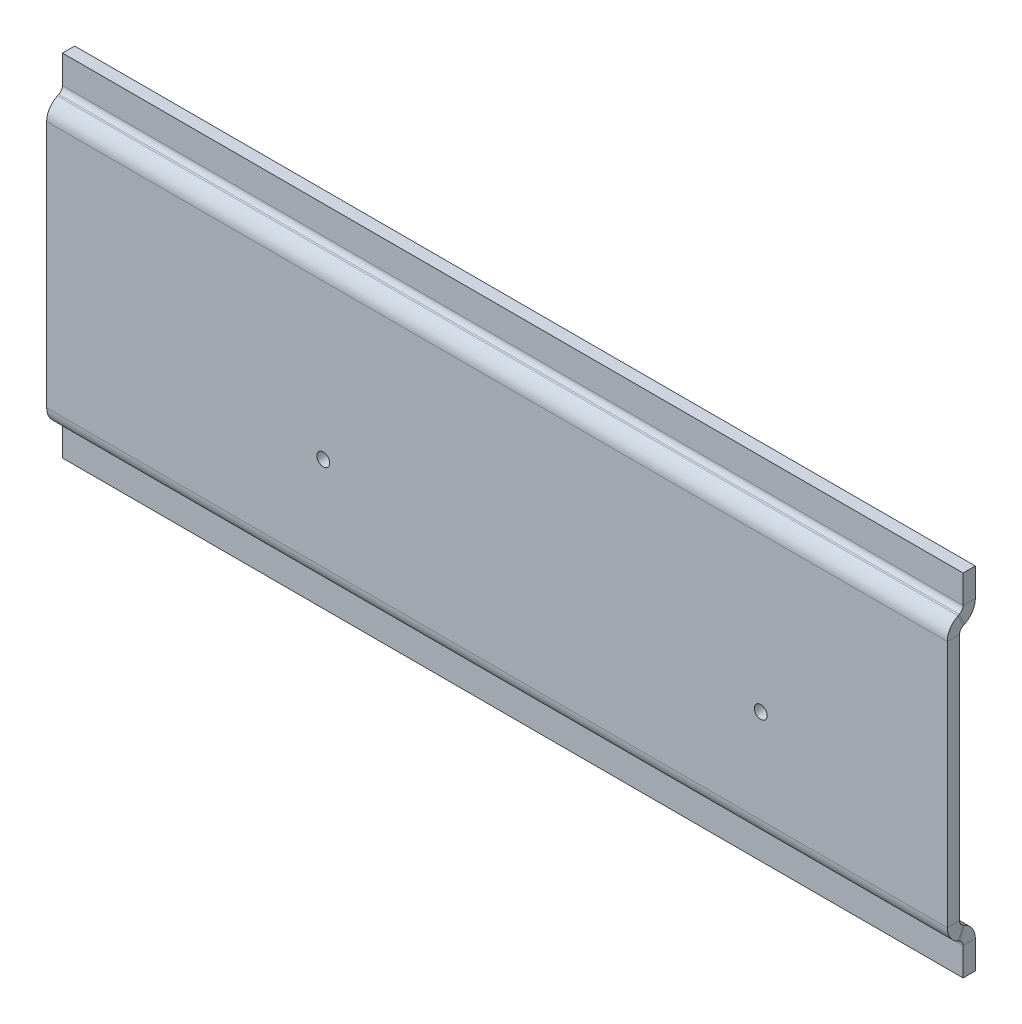
from build123d import *

# Parameters (mm, degrees)
SKETCH1_W                      = 140
SKETCH1_H                      = 44
BASE_FLANGE1_DEPTH             = 1.9
EDGE_FLANGE1_DEPTH             = 140
EDGE_FLANGE1_2_DEPTH           = 140
EDGE_FLANGE2_STRIP_CUT_DEPTH   = 140
EDGE_FLANGE2_STRIP_CUT_2_DEPTH = 140
EDGE_FLANGE2_DEPTH             = 140
EDGE_FLANGE2_BEND_DEPTH        = 140
SKETCH40_R                     = 1
CUT_EXTRUDE1_DEPTH             = 5


# Read off the part's stored shape, not the designer's step: Edge-Flange1
# Sheet-metal steps are written as plain solids
with BuildPart() as part:
    # Sketch1 → Base-Flange1 (new body)
    with BuildSketch(Plane.XY):
        with Locations((70, 22)):
            Rectangle(SKETCH1_W, SKETCH1_H)
    extrude(amount=-BASE_FLANGE1_DEPTH)

    # Edge-Flange1 outline → Edge-Flange1 (cut)
    with BuildSketch(Plane.YZ):
        with BuildLine():
            ThreePointArc((41.266511693, 0), (42.824680557, -0.454164807), (43.894804276, -1.674407041))
            Line((43.894804276, -1.674407041), (44, -1.9))
            Line((44, -1.9), (44, 0))
            Line((44, 0), (41.266511693, 0))
        make_face()
        with BuildLine():
            ThreePointArc((0.105195724, -1.674407041), (1.175319443, -0.454164807), (2.733488307, 0))
            Line((2.733488307, 0), (0, 0))
            Line((0, 0), (0, -1.9))
            Line((0, -1.9), (0.105195724, -1.674407041))
        make_face()
    extrude(amount=EDGE_FLANGE1_DEPTH, mode=Mode.SUBTRACT)

    # Edge-Flange1 2 outline → Edge-Flange1 2 (add)
    with BuildSketch(Plane.YZ):
        with BuildLine():
            Line((44.259494142, -2.456486983), (44, -1.9))
            Line((44, -1.9), (41.266511693, -1.9))
            ThreePointArc((41.266511693, -1.9), (41.803811302, -2.056608554), (42.17281948, -2.477381738))
            Line((42.17281948, -2.477381738), (42.537509347, -3.259461681))
            Line((42.537509347, -3.259461681), (44.259494142, -2.456486983))
        make_face()
        with BuildLine():
            ThreePointArc((1.82718052, -2.477381738), (2.196188698, -2.056608554), (2.733488307, -1.9))
            Line((2.733488307, -1.9), (0, -1.9))
            Line((0, -1.9), (-0.259494142, -2.456486983))
            Line((-0.259494142, -2.456486983), (1.462490653, -3.259461681))
            Line((1.462490653, -3.259461681), (1.82718052, -2.477381738))
        make_face()
    extrude(amount=EDGE_FLANGE1_2_DEPTH)

    # Edge-Flange2 strip (across the edge) → Edge-Flange2 strip cut (cut)
    with BuildSketch(Plane(origin=(140, 44.259494142, -2.456486983), x_dir=(0, 0, 1), z_dir=(-1, 0, 0))):
        Polygon((-8.926147715, 2.065912991), (-0.225592959, -1.991222322), (0.577381738, -0.269237526), (-8.123173017, 3.787897786), align=None)
    extrude(amount=EDGE_FLANGE2_STRIP_CUT_DEPTH, mode=Mode.SUBTRACT)

    # Edge-Flange2 strip 2 (across the edge) → Edge-Flange2 strip cut 2 (cut)
    with BuildSketch(Plane(origin=(0, -0.259494142, -2.456486983), x_dir=(0, 0, 1), z_dir=(1, 0, 0))):
        Polygon((-8.926147715, 2.065912991), (-0.225592959, -1.991222322), (0.577381738, -0.269237526), (-8.123173017, 3.787897786), align=None)
    extrude(amount=EDGE_FLANGE2_STRIP_CUT_2_DEPTH, mode=Mode.SUBTRACT)

    # Edge-Flange2 section (across the edge) → Edge-Flange2 (add)
    with BuildSketch(Plane(origin=(140, 44.259494142, -2.456486983), x_dir=(0, 0, 1), z_dir=(-1, 0, 0))):
        with BuildLine():
            Line((-1.9, 0.637070261), (-1.9, 5))
            Line((-1.9, 5), (0, 5))
            Line((0, 5), (0, 0.637070261))
            ThreePointArc((0, 0.637070261), (0.156608554, 0.099770652), (0.577381738, -0.269237526))
            Line((0.577381738, -0.269237526), (-0.225592959, -1.991222322))
            ThreePointArc((-0.225592959, -1.991222322), (-1.445835193, -0.921098603), (-1.9, 0.637070261))
        make_face()
    extrude(amount=EDGE_FLANGE2_DEPTH)

    # Edge-Flange2 section 2 (across the edge) → Edge-Flange2 bend (add)
    with BuildSketch(Plane(origin=(0, -0.259494142, -2.456486983), x_dir=(0, 0, 1), z_dir=(1, 0, 0))):
        with BuildLine():
            Line((-1.9, 0.637070261), (-1.9, 5))
            Line((-1.9, 5), (0, 5))
            Line((0, 5), (0, 0.637070261))
            ThreePointArc((0, 0.637070261), (0.156608554, 0.099770652), (0.577381738, -0.269237526))
            Line((0.577381738, -0.269237526), (-0.225592959, -1.991222322))
            ThreePointArc((-0.225592959, -1.991222322), (-1.445835193, -0.921098603), (-1.9, 0.637070261))
        make_face()
    extrude(amount=EDGE_FLANGE2_BEND_DEPTH)

    # Sketch40 → Cut-Extrude1 (cut)
    with BuildSketch(Plane.XY):
        with Locations((111, 17.28174)):
            Circle(SKETCH40_R)
        with Locations((43, 17.28174)):
            Circle(SKETCH40_R)
    extrude(amount=-CUT_EXTRUDE1_DEPTH, mode=Mode.SUBTRACT)


solid = part.part
